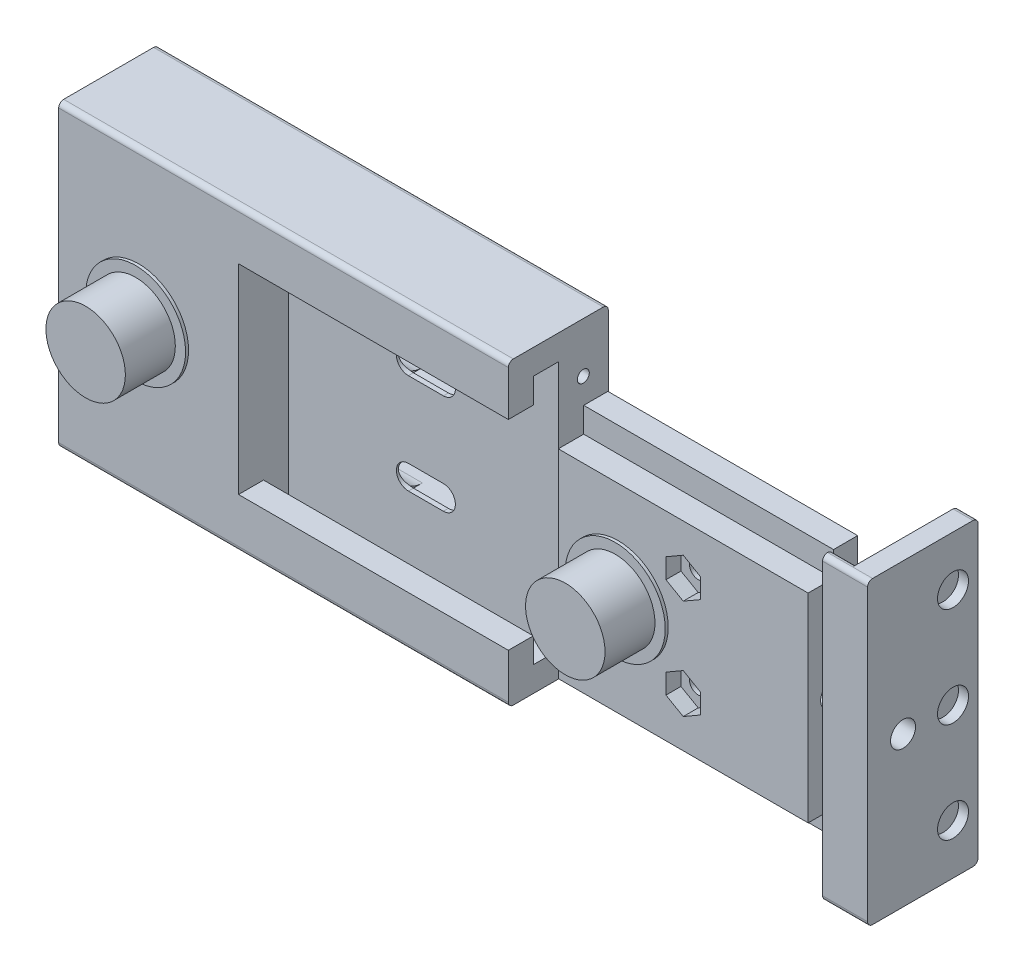
from build123d import *

# Parameters (mm, degrees)
SKETCH1_W           = 90
SKETCH1_H           = 60
BOSS_EXTRUDE1_DEPTH = 20
SKETCH2_R           = 10
BOSS_EXTRUDE2_DEPTH = 0.6
SKETCH3_R           = 7.95
BOSS_EXTRUDE3_DEPTH = 10
CUT_EXTRUDE2_DEPTH  = 54
SKETCH14_R          = 1.75
CUT_EXTRUDE4_DEPTH  = 18
BOSS_EXTRUDE4_DEPTH = 50
SKETCH10_R          = 10
BOSS_EXTRUDE5_DEPTH = 0.6
SKETCH11_R          = 7.95
BOSS_EXTRUDE6_DEPTH = 10
SKETCH16_R          = 1.75
CUT_EXTRUDE5_DEPTH  = 9.92
CUT_EXTRUDE6_DEPTH  = 3
CUT_EXTRUDE8_DEPTH  = 62
CUT_EXTRUDE9_DEPTH  = 10
SKETCH24_W          = 16.4
SKETCH24_H          = 9.6
SKETCH24_W_2        = 12
CUT_EXTRUDE10_DEPTH = 9
FILLET1_R           = 0.8
CUT_EXTRUDE11_DEPTH = 3
CUT_EXTRUDE12_START = -16.008142
SKETCH27_W          = 3
SKETCH27_H          = 6.9
CUT_EXTRUDE12_DEPTH = 16.008142
SKETCH28_R          = 1.2
CUT_EXTRUDE13_DEPTH = 15
SKETCH29_R          = 2.5
CUT_EXTRUDE14_DEPTH = 40
CUT_EXTRUDE15_DEPTH = 3.4
SKETCH31_W          = 20.1
SKETCH31_H          = 60
SKETCH31_R          = 1.55
SKETCH31_R_2        = 2.5
BOSS_EXTRUDE7_DEPTH = 4
SKETCH32_R          = 3.1
CUT_EXTRUDE16_DEPTH = 2
SKETCH33_W          = 2
SKETCH33_H          = 60
BOSS_EXTRUDE8_DEPTH = 9
FILLET2_R           = 1
FILLET3_R           = 1
SKETCH34_R          = 1.55
BOSS_EXTRUDE9_DEPTH = 0.6


with BuildPart() as part:
    # Sketch1 → Boss-Extrude1 (new body)
    with BuildSketch(Plane.XY):
        Rectangle(SKETCH1_W, SKETCH1_H)
    extrude(amount=BOSS_EXTRUDE1_DEPTH)

    # Sketch2 → Boss-Extrude2 (add)
    with BuildSketch(Plane.XY.offset(20)):
        with Locations((-29, 0)):
            Circle(SKETCH2_R)
    extrude(amount=BOSS_EXTRUDE2_DEPTH)

    # Sketch3 → Boss-Extrude3 (add)
    with BuildSketch(Plane.XY.offset(20.6)):
        with Locations((-29, 0)):
            Circle(SKETCH3_R)
    extrude(amount=BOSS_EXTRUDE3_DEPTH)

    # Sketch6 → Cut-Extrude2 (cut)
    with BuildSketch(Plane(origin=(45, 0, 0), x_dir=(0, 0, -1), z_dir=(1, 0, 0))):
        Polygon((-20, 20), (-15, 20), (-15, 25), (-10, 25), (-10, -25), (-15, -25), (-15, -20), (-20, -20), align=None)
    extrude(amount=-CUT_EXTRUDE2_DEPTH, mode=Mode.SUBTRACT)

    # Sketch14 → Cut-Extrude4 (cut)
    with BuildSketch(Plane(origin=(0, 0, 0), x_dir=(-1, 0, 0), z_dir=(0, 0, -1))):
        with Locations((27, 10)):
            Circle(SKETCH14_R)
        with Locations((27, -10)):
            Circle(SKETCH14_R)
    extrude(amount=-CUT_EXTRUDE4_DEPTH, mode=Mode.SUBTRACT)

    # Sketch20 → Cut-Extrude8 (cut)
    with BuildSketch(Plane.ZY.offset(33)):
        with BuildLine():
            Line((0, 5.2), (4.8, 5.2))
            ThreePointArc((4.8, 5.2), (9.6, 10), (4.8, 14.8))
            Line((4.8, 14.8), (0, 14.8))
            Line((0, 14.8), (0, 5.2))
        make_face()
        with BuildLine():
            Line((0, -14.8), (4.8, -14.8))
            ThreePointArc((4.8, -14.8), (9.6, -10), (4.8, -5.2))
            Line((4.8, -5.2), (0, -5.2))
            Line((0, -5.2), (0, -14.8))
        make_face()
    extrude(amount=-CUT_EXTRUDE8_DEPTH, mode=Mode.SUBTRACT)

    # Sketch22 → Cut-Extrude9 (cut)
    with BuildSketch(Plane(origin=(0, 0, 0), x_dir=(-1, 0, 0), z_dir=(0, 0, -1))):
        with BuildLine():
            Line((-22, 12.4), (-15, 12.4))
            ThreePointArc((-15, 12.4), (-12.6, 10), (-15, 7.6))
            Line((-15, 7.6), (-22, 7.6))
            ThreePointArc((-22, 7.6), (-24.4, 10), (-22, 12.4))
        make_face()
        with BuildLine():
            Line((-22, -7.6), (-15, -7.6))
            ThreePointArc((-15, -7.6), (-12.6, -10), (-15, -12.4))
            Line((-15, -12.4), (-22, -12.4))
            ThreePointArc((-22, -12.4), (-24.4, -10), (-22, -7.6))
        make_face()
    extrude(amount=-CUT_EXTRUDE9_DEPTH, mode=Mode.SUBTRACT)

    # Sketch24 → Cut-Extrude10 (cut)
    with BuildSketch(Plane(origin=(0, 0, 0), x_dir=(-1, 0, 0), z_dir=(0, 0, -1))):
        with Locations((-20.8, 10)):
            Rectangle(SKETCH24_W, SKETCH24_H)
        with Locations((-20.8, -10)):
            Rectangle(SKETCH24_W, SKETCH24_H)
        with Locations((27, 10)):
            Rectangle(SKETCH24_W_2, SKETCH24_H)
        with Locations((27, -10)):
            Rectangle(SKETCH24_W_2, SKETCH24_H)
    extrude(amount=-CUT_EXTRUDE10_DEPTH, mode=Mode.SUBTRACT)

    # Fillet1
    fillet1_edges = [part.edges().sort_by_distance(p)[0] for p in [
        (-21, 5.2, 6.9),
        (-21, 6.438104996, 9),
        (-21, 13.561895004, 9),
        (-27, 5.2, 9),
        (-27, 14.8, 9),
        (-21, 14.8, 6.9),
        (-21, -14.8, 6.9),
        (-21, -13.561895004, 9),
        (-21, -6.438104996, 9),
        (-27, -14.8, 9),
        (-27, -5.2, 9),
        (-21, -5.2, 6.9),
    ]]
    fillet(fillet1_edges, radius=FILLET1_R)

    # Sketch26 → Cut-Extrude11 (cut)
    with BuildSketch(Plane(origin=(0, 0, 18), x_dir=(-1, 0, 0), z_dir=(0, 0, -1))):
        Polygon((23.016283143, 10), (25.008141571, 6.55), (28.991858429, 6.55), (30.983716857, 10), (28.991858429, 13.45), (25.008141571, 13.45), align=None)
        Polygon((23.016283143, -10), (25.008141571, -13.45), (28.991858429, -13.45), (30.983716857, -10), (28.991858429, -6.55), (25.008141571, -6.55), align=None)
    extrude(amount=CUT_EXTRUDE11_DEPTH, mode=Mode.SUBTRACT)

    # Sketch27 → Cut-Extrude12 (cut)
    with BuildSketch(Plane.ZY.offset(45).offset(CUT_EXTRUDE12_START)):
        with Locations((16.5, -10)):
            Rectangle(SKETCH27_W, SKETCH27_H)
        with Locations((16.5, 10)):
            Rectangle(SKETCH27_W, SKETCH27_H)
    extrude(amount=CUT_EXTRUDE12_DEPTH, mode=Mode.SUBTRACT)

    # Sketch28 → Cut-Extrude13 (cut)
    with BuildSketch(Plane(origin=(45, 0, 0), x_dir=(0, 0, -1), z_dir=(1, 0, 0))):
        with Locations(Location((-5, 20, 0), (0, 0, 90))):
            Circle(SKETCH28_R)
        with Locations(Location((-5, 0, 0), (0, 0, 90))):
            Circle(SKETCH28_R)
        with Locations(Location((-5, -20, 0), (0, 0, 90))):
            Circle(SKETCH28_R)
    extrude(amount=-CUT_EXTRUDE13_DEPTH, mode=Mode.SUBTRACT)

    # Fillet2
    fillet2_edges = [part.edges().sort_by_distance(p)[0] for p in [
        (0, -30, 20),
        (0, -30, 0),
        (0, 30, 0),
        (0, 30, 20),
    ]]
    fillet(fillet2_edges, radius=FILLET2_R)


with BuildPart() as body_2:
    # Sketch7 → Boss-Extrude4 (new body)
    with BuildSketch(Plane(origin=(55, 0, 0), x_dir=(0, 0, -1), z_dir=(1, 0, 0))):
        Polygon((-20, -19.92), (-14.92, -19.92), (-14.92, -24.92), (-10.08, -24.92), (-10.08, 24.92), (-14.92, 24.92), (-14.92, 19.92), (-20, 19.92), align=None)
    extrude(amount=BOSS_EXTRUDE4_DEPTH)

    # Sketch10 → Boss-Extrude5 (add)
    with BuildSketch(Plane.XY.offset(20)):
        with Locations((67, 0)):
            Circle(SKETCH10_R)
    extrude(amount=BOSS_EXTRUDE5_DEPTH)

    # Sketch11 → Boss-Extrude6 (add)
    with BuildSketch(Plane.XY.offset(20.6)):
        with Locations((67, 0)):
            Circle(SKETCH11_R)
    extrude(amount=BOSS_EXTRUDE6_DEPTH)

    # Sketch16 → Cut-Extrude5 (cut)
    with BuildSketch(Plane(origin=(0, 0, 10.08), x_dir=(-1, 0, 0), z_dir=(0, 0, -1))):
        with Locations((-80, 10)):
            Circle(SKETCH16_R)
        with Locations((-80, -10)):
            Circle(SKETCH16_R)
    extrude(amount=-CUT_EXTRUDE5_DEPTH, mode=Mode.SUBTRACT)

    # Sketch17 → Cut-Extrude6 (cut)
    with BuildSketch(Plane.XY.offset(20)):
        Polygon((80, -6.016283143), (76.55, -8.008141571), (76.55, -11.991858429), (80, -13.983716857), (83.45, -11.991858429), (83.45, -8.008141571), align=None)
        Polygon((80, 13.983716857), (76.55, 11.991858429), (76.55, 8.008141571), (80, 6.016283143), (83.45, 8.008141571), (83.45, 11.991858429), align=None)
    extrude(amount=-CUT_EXTRUDE6_DEPTH, mode=Mode.SUBTRACT)

    # Sketch29 → Cut-Extrude14 (cut)
    with BuildSketch(Plane(origin=(105, 0, 0), x_dir=(0, 0, -1), z_dir=(1, 0, 0))):
        with Locations((-15, 0)):
            Circle(SKETCH29_R)
    extrude(amount=-CUT_EXTRUDE14_DEPTH, mode=Mode.SUBTRACT)

    # Sketch30 → Cut-Extrude15 (cut)
    with BuildSketch(Plane(origin=(75, 0, 0), x_dir=(0, 0, -1), z_dir=(1, 0, 0))):
        Polygon((-12.719466437, 3.95), (-10.08, 3.95), (-10.08, -3.95), (-12.719466437, -3.95), (-17.280533563, -3.95), (-19.561067127, 0), (-17.280533563, 3.95), align=None)
    extrude(amount=-CUT_EXTRUDE15_DEPTH, mode=Mode.SUBTRACT)


with BuildPart() as body_3:
    # Sketch31 → Boss-Extrude7 (new body)
    with BuildSketch(Plane(origin=(115, 0, 0), x_dir=(0, 0, -1), z_dir=(1, 0, 0))):
        with Locations((-10.05, 0)):
            Rectangle(SKETCH31_W, SKETCH31_H)
        with Locations((-5, 20)):
            Circle(SKETCH31_R, mode=Mode.SUBTRACT)
        with Locations((-5, 0)):
            Circle(SKETCH31_R, mode=Mode.SUBTRACT)
        with Locations((-5, -20)):
            Circle(SKETCH31_R, mode=Mode.SUBTRACT)
        with Locations((-15, 0)):
            Circle(SKETCH31_R_2, mode=Mode.SUBTRACT)
    extrude(amount=BOSS_EXTRUDE7_DEPTH)

    # Sketch32 → Cut-Extrude16 (cut)
    with BuildSketch(Plane(origin=(119, 0, 0), x_dir=(0, 0, -1), z_dir=(1, 0, 0))):
        with Locations((-5, 20)):
            Circle(SKETCH32_R)
        with Locations((-5, 0)):
            Circle(SKETCH32_R)
        with Locations((-5, -20)):
            Circle(SKETCH32_R)
    extrude(amount=-CUT_EXTRUDE16_DEPTH, mode=Mode.SUBTRACT)

    # Sketch33 → Boss-Extrude8 (add)
    with BuildSketch(Plane(origin=(119, 0, 0), x_dir=(0, 0, -1), z_dir=(1, 0, 0))):
        with Locations((-21.1, 0)):
            Rectangle(SKETCH33_W, SKETCH33_H)
    extrude(amount=-BOSS_EXTRUDE8_DEPTH)

    # Fillet3
    fillet3_edges = [body_3.edges().sort_by_distance(p)[0] for p in [
        (112.5, -30, 20.1),
        (117, -30, 0),
        (114.5, -30, 22.1),
        (112.5, 30, 20.1),
        (114.5, 30, 22.1),
        (117, 30, 0),
    ]]
    fillet(fillet3_edges, radius=FILLET3_R - 0.0001)  # a hair under: the kernel refuses the full size

    # Sketch34 → Boss-Extrude9 (add)
    with BuildSketch(Plane(origin=(117, 0, 0), x_dir=(0, 0, -1), z_dir=(1, 0, 0))):
        with Locations((-5, -20)):
            Circle(SKETCH34_R)
        with Locations((-5, 0)):
            Circle(SKETCH34_R)
        with Locations((-5, 20)):
            Circle(SKETCH34_R)
    extrude(amount=-BOSS_EXTRUDE9_DEPTH)


solid = Compound([part.part, body_2.part, body_3.part])
